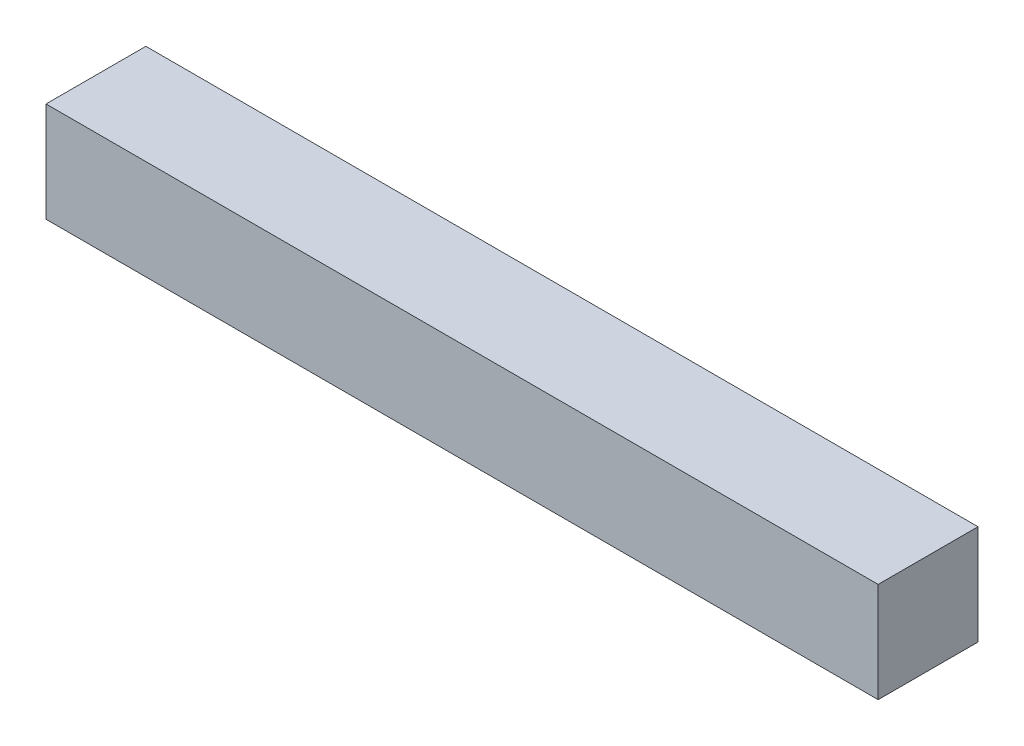
from build123d import *

# Parameters (mm, degrees)
SZKIC1_W                    = 500
SZKIC1_H                    = 60
DODANIE_WYCI_GNI_CIE1_DEPTH = 60
SZKIC2_R                    = 25
WYTNIJ_WYCI_GNI_CIE1_DEPTH  = 25
ZAOKR_GLENIE2_R             = 25


with BuildPart() as part:
    # Szkic1 → Dodanie-wyciągnięcie1 (new body)
    with BuildSketch(Plane.XY):
        Rectangle(SZKIC1_W, SZKIC1_H)
    extrude(amount=DODANIE_WYCI_GNI_CIE1_DEPTH)

    # Szkic2 → Wytnij-wyciągnięcie1 (cut)
    with BuildSketch(Plane(origin=(0, 0, 0), x_dir=(-1, 0, 0), z_dir=(0, 0, -1))):
        with Locations((-187.5, 0)):
            Circle(SZKIC2_R)
        with Locations((-125, 0)):
            Circle(SZKIC2_R)
        with Locations((-62.5, 0)):
            Circle(SZKIC2_R)
        Circle(SZKIC2_R)
        with Locations((62.5, 0)):
            Circle(SZKIC2_R)
        with Locations((125, 0)):
            Circle(SZKIC2_R)
        with Locations((187.5, 0)):
            Circle(SZKIC2_R)
    extrude(amount=-WYTNIJ_WYCI_GNI_CIE1_DEPTH, mode=Mode.SUBTRACT)

    # Zaokrąglenie2
    zaokr_glenie2_edges = [part.edges().sort_by_distance(p)[0] for p in [
        (212.5, 0, 25),
        (150, 0, 25),
        (87.5, 0, 25),
        (25, 0, 25),
        (-37.5, 0, 25),
        (-100, 0, 25),
        (-162.5, 0, 25),
    ]]
    fillet(zaokr_glenie2_edges, radius=ZAOKR_GLENIE2_R - 0.0001)  # a hair under: the kernel refuses the full size


solid = part.part
